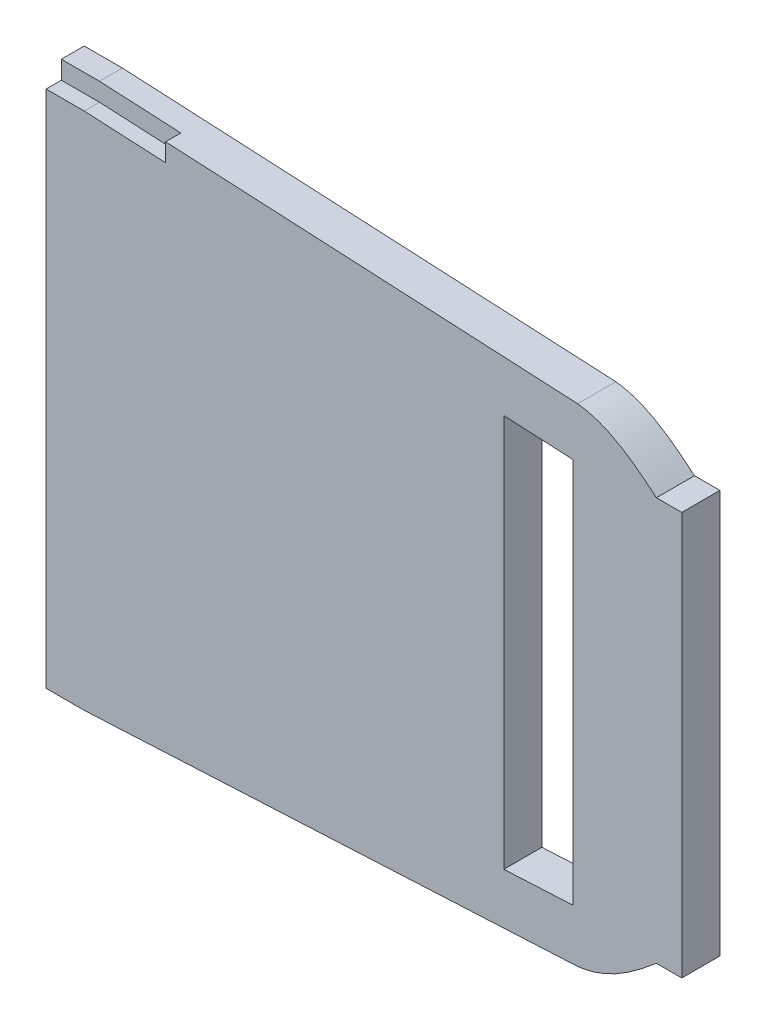
from build123d import *

# Parameters (mm, degrees)
STOCK_BATTERY_BASE_1_DEPTH   = 7.5
STOCK_BATTERY_BASE_1_2_DEPTH = 4.5
BOSS_EXTRUDE1_DEPTH          = 7.5
CUT_EXTRUDE1_DEPTH           = 7.5


# Read off the part's stored shape, not the designer's step: Stock-battery base-1
with BuildPart() as part:
    # Stock-battery base-1 outline → Stock-battery base-1 (new body)
    with BuildSketch(Plane.XY):
        with BuildLine():
            Line((32.459100066, 42.420690995), (16.459100066, 43.22938712))
            Line((16.459100066, 43.22938712), (16.459100066, -58.832087736))
            Line((16.459100066, -58.832087736), (113.496599029, -53.92747215))
            add(Edge.make_bspline(
                [(113.496599029, -53.92747215), (114.973875685, -53.76034768), (116.389465073, -53.408303088), (118.438931288, -52.658652366), (119.109837198, -52.372048444), (120.430638868, -51.735858399), (121.082915856, -51.384782434), (122.988929436, -50.267489711), (124.197203446, -49.437169981), (126.541735842, -47.677906536), (127.677620036, -46.748450374), (128.850515141, -45.74891878), (128.904828159, -45.702543351), (128.959100066, -45.656116492)],
                knots=[0, 0, 0, 0, 0.125, 0.125, 0.1875, 0.1875, 0.25, 0.25, 0.375, 0.375, 0.5, 0.5, 0.506074438, 0.506074438, 0.506074438, 0.506074438], degree=3))
            Line((128.959100066, -45.656116492), (133.959100066, -45.656116492))
            Line((133.959100066, -45.656116492), (133.959100066, 33.628624999))
            Line((133.959100066, 33.628624999), (128.959100066, 33.628624999))
            add(Edge.make_bspline(
                [(128.959100066, 33.628624999), (128.913387154, 33.667730585), (127.751192536, 34.660386778), (126.568806099, 35.629041088), (124.805320754, 36.953884089), (124.207009004, 37.38378621), (122.992052543, 38.206145046), (122.374602128, 38.599251589), (120.484333172, 39.709851881), (119.174169326, 40.359663675), (117.093195419, 41.124643977), (116.387101294, 41.341482025), (114.957490187, 41.687263925), (114.232477088, 41.816732683), (113.496599029, 41.899982649)],
                knots=[0.494878569, 0.494878569, 0.494878569, 0.494878569, 0.5, 0.625, 0.625, 0.6875, 0.6875, 0.75, 0.75, 0.875, 0.875, 0.9375, 0.9375, 1, 1, 1, 1], degree=3))
            Line((113.496599029, 41.899982649), (32.459100066, 45.99590211))
            Line((32.459100066, 45.99590211), (32.459100066, 42.420690995))
        make_face()
        Polygon((112.616329261, 31.931709487), (112.616012614, -43.959214992), (98.959100066, -44.649483258), (98.959100066, 32.621993758), align=None, mode=Mode.SUBTRACT)
    extrude(amount=STOCK_BATTERY_BASE_1_DEPTH)

    # Stock-battery base-1 2 outline → Stock-battery base-1 2 (add)
    with BuildSketch(Plane.XY):
        Polygon((32.459100066, 45.99590211), (16.459100066, 46.804598235), (16.459100066, 43.22938712), (32.459100066, 42.420690995), align=None)
    extrude(amount=STOCK_BATTERY_BASE_1_2_DEPTH)

    # Sketch1 → Boss-Extrude1 (add)
    with BuildSketch(Plane.ZY.offset(-16.459100066)):
        Polygon((0, 46.804598235), (0, -58.832087736), (7.5, -58.832087736), (7.5, 43.22938712), (4.5, 43.22938712), (4.5, 46.804598235), align=None)
    extrude(amount=BOSS_EXTRUDE1_DEPTH)

    # Sketch2 → Cut-Extrude1 (cut)
    with BuildSketch(Plane.ZY.offset(-8.959100066)):
        Polygon((2.7, 41.42938712), (1.8, 41.42938712), (1.8, -57.032087736), (5.7, -57.032087736), (5.7, 41.42938712), align=None)
    extrude(amount=-CUT_EXTRUDE1_DEPTH, mode=Mode.SUBTRACT)


solid = part.part
